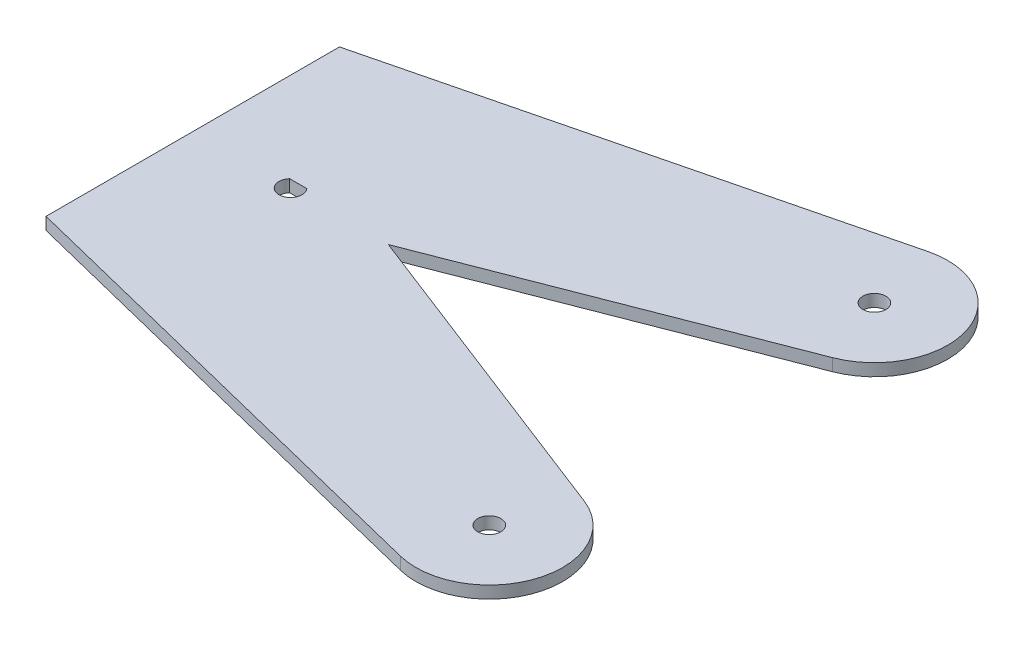
from build123d import *

# Parameters (mm, degrees)
SKETCH1_R           = 3
BOSS_EXTRUDE1_DEPTH = 1.5875


with BuildPart() as part:
    # Sketch1 → Boss-Extrude1 (new, symmetric)
    with BuildSketch(Plane(origin=(0, 0, 0), x_dir=(1, 0, 0), z_dir=(0, 1, 0))):
        with BuildLine():
            Line((97.010086235, 68.488785564), (-25.4, 38.1))
            Line((-25.4, 38.1), (-25.4, -38.1))
            Line((-25.4, -38.1), (97.010086235, -68.488785564))
            ThreePointArc((97.010086235, -68.488785564), (119.760857484, -55.752021858), (108.491020074, -32.240035407))
            Line((108.491020074, -32.240035407), (25.4, 0))
            Line((25.4, 0), (108.491020074, 32.240035407))
            ThreePointArc((108.491020074, 32.240035407), (119.760857484, 55.752021858), (97.010086235, 68.488785564))
        make_face()
        with BuildLine():
            ThreePointArc((2.236067977, 2), (0, -3), (-2.236067977, 2))
            Line((-2.236067977, 2), (2.236067977, 2))
        make_face(mode=Mode.SUBTRACT)
        with Locations((101.6, -50)):
            Circle(SKETCH1_R, mode=Mode.SUBTRACT)
        with Locations((101.6, 50)):
            Circle(SKETCH1_R, mode=Mode.SUBTRACT)
    extrude(amount=BOSS_EXTRUDE1_DEPTH, both=True)


solid = part.part
